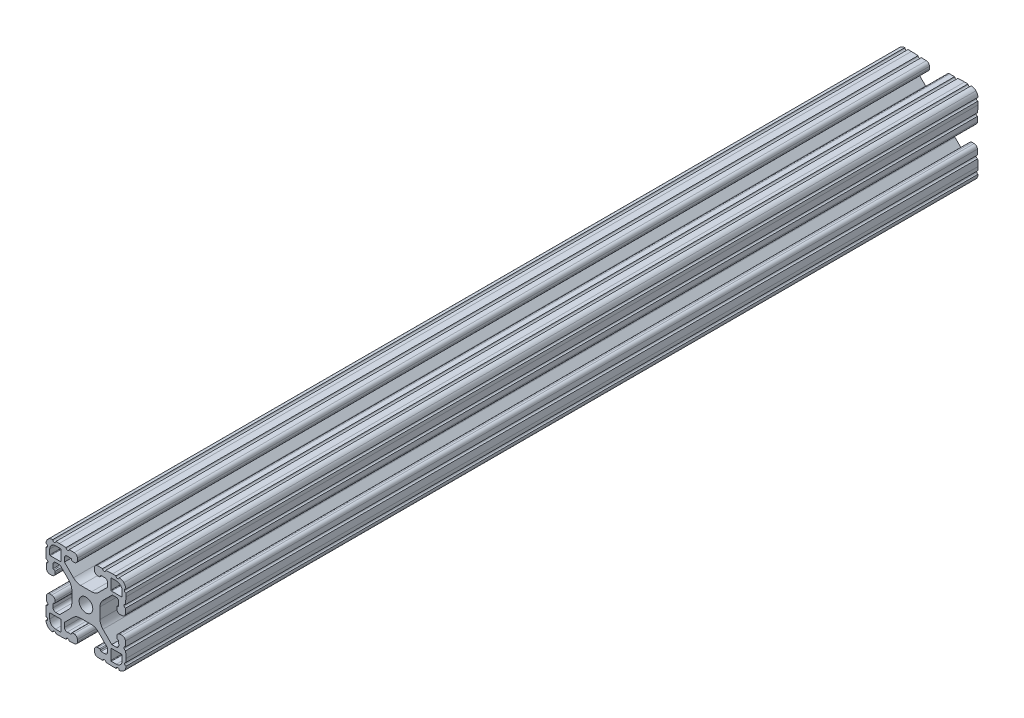
from build123d import *

# Parameters (mm, degrees)
SKETCH1_R           = 3.2639
BOSS_EXTRUDE1_DEPTH = 406.4


with BuildPart() as part:
    # Sketch1 → Boss-Extrude1 (new body)
    with BuildSketch(Plane(origin=(0, 0, -25.4), x_dir=(-1, 0, 0), z_dir=(0, 0, -1))):
        with BuildLine():
            Line((-88.043721549, 91.862643967), (-86.29674679, 91.923648859))
            ThreePointArc((-86.29674679, 91.923648859), (-85.370208675, 91.567983831), (-84.982425017, 90.654422489))
            Line((-84.982425017, 90.654422489), (-84.982425017, 88.800173916))
            Line((-84.982425017, 88.800173916), (-89.306565884, 84.476033049))
            ThreePointArc((-89.306565884, 84.476033049), (-90.866149908, 83.406077005), (-92.719610366, 83.029523439))
            Line((-92.719610366, 83.029523439), (-97.961628589, 83.029523439))
            ThreePointArc((-97.961628589, 83.029523439), (-99.779298356, 83.391080435), (-101.320244378, 84.42070765))
            Line((-101.320244378, 84.42070765), (-105.516001761, 88.616465033))
            Line((-105.516001761, 88.616465033), (-105.516001761, 90.731330035))
            ThreePointArc((-105.516001761, 90.731330035), (-105.128218103, 91.644891377), (-104.201679988, 92.000556406))
            Line((-104.201679988, 92.000556406), (-102.454705229, 91.939551513))
            ThreePointArc((-102.454705229, 91.939551513), (-102.193933359, 91.823448504), (-102.087001761, 91.558783602))
            ThreePointArc((-102.087001761, 91.558783602), (-102.010859042, 91.249291513), (-101.726191901, 91.105946874))
            Line((-101.726191901, 91.105946874), (-100.929727576, 91.078102142))
            ThreePointArc((-100.929727576, 91.078102142), (-99.780779944, 91.519102656), (-99.299905511, 92.651940638))
            Line((-99.299905511, 92.651940638), (-99.299905511, 93.566848638))
            ThreePointArc((-99.299905511, 93.566848638), (-99.741889517, 94.660796975), (-100.819746715, 95.140689345))
            Line((-100.819746715, 95.140689345), (-103.211918901, 95.224224422))
            ThreePointArc((-103.211918901, 95.224224422), (-104.000045777, 94.489281495), (-104.734990687, 95.277406522))
            Line((-104.734990687, 95.277406522), (-107.935905676, 95.389166912))
            Line((-107.935905676, 95.389166912), (-109.561454876, 95.389166912))
            ThreePointArc((-109.561454876, 95.389166912), (-110.323454876, 94.627166912), (-111.085454876, 95.389166912))
            ThreePointArc((-111.085454876, 95.389166912), (-112.308767787, 95.144035599), (-113.343184761, 94.446493225))
            ThreePointArc((-113.343184761, 94.446493225), (-114.04072548, 93.412075135), (-114.285854836, 92.188761832))
            ThreePointArc((-114.285854836, 92.188761832), (-113.523853616, 91.426762441), (-114.285853616, 90.664761832))
            Line((-114.285853616, 90.664761832), (-114.285853616, 89.039212632))
            Line((-114.285853616, 89.039212632), (-114.174093219, 85.838297643))
            ThreePointArc((-114.174093219, 85.838297643), (-113.385968191, 85.103352735), (-114.120911115, 84.315225857))
            Line((-114.120911115, 84.315225857), (-114.037376031, 81.923053667))
            ThreePointArc((-114.037376031, 81.923053667), (-113.55748366, 80.845196472), (-112.463535325, 80.403212468))
            Line((-112.463535325, 80.403212468), (-111.548627325, 80.403212468))
            ThreePointArc((-111.548627325, 80.403212468), (-110.415788905, 80.884087354), (-109.974788872, 82.033035791))
            Line((-109.974788872, 82.033035791), (-110.002634241, 82.829500094))
            ThreePointArc((-110.002634241, 82.829500094), (-110.118742417, 83.090261917), (-110.383401914, 83.197188))
            ThreePointArc((-110.383401914, 83.197188), (-110.693757401, 83.272605688), (-110.837665276, 83.557735272))
            Line((-110.837665276, 83.557735272), (-110.898671566, 85.304709982))
            ThreePointArc((-110.898671566, 85.304709982), (-110.543006925, 86.231248747), (-109.62944523, 86.61903277))
            Line((-109.62944523, 86.61903277), (-107.807161806, 86.61903277))
            Line((-107.807161806, 86.61903277), (-103.364925613, 82.176810793))
            ThreePointArc((-103.364925613, 82.176810793), (-102.335294479, 80.635862907), (-101.973736029, 78.81818963))
            Line((-101.973736029, 78.81818963), (-101.973736029, 73.576034207))
            ThreePointArc((-101.973736029, 73.576034207), (-102.335293752, 71.758362684), (-103.364922926, 70.21741573))
            Line((-103.364922926, 70.21741573), (-107.560683666, 66.021661704))
            Line((-107.560683666, 66.021661704), (-109.652436558, 66.021661704))
            ThreePointArc((-109.652436558, 66.021661704), (-110.565998503, 66.409445617), (-110.921663765, 67.335984343))
            Line((-110.921663765, 67.335984343), (-110.860658873, 69.082959102))
            ThreePointArc((-110.860658873, 69.082959102), (-110.744555864, 69.343730973), (-110.479890961, 69.45066257))
            ThreePointArc((-110.479890961, 69.45066257), (-110.173494703, 69.529390272), (-110.032185196, 69.812424443))
            Line((-110.032185196, 69.812424443), (-110.004340464, 70.608888768))
            ThreePointArc((-110.004340464, 70.608888768), (-110.445340978, 71.7578364), (-111.57817896, 72.238710833))
            Line((-111.57817896, 72.238710833), (-112.49308696, 72.238710833))
            ThreePointArc((-112.49308696, 72.238710833), (-113.587035297, 71.796726827), (-114.066927667, 70.718869629))
            Line((-114.066927667, 70.718869629), (-114.150462744, 68.326697443))
            ThreePointArc((-114.150462744, 68.326697443), (-113.415519817, 67.538570567), (-114.203644843, 66.803625657))
            Line((-114.203644843, 66.803625657), (-114.315405233, 63.602710668))
            Line((-114.315405233, 63.602710668), (-114.315405233, 61.962557497))
            ThreePointArc((-114.315405233, 61.962557497), (-113.701927281, 61.206106537), (-114.333208228, 60.464447842))
            ThreePointArc((-114.333208228, 60.464447842), (-114.113020459, 59.176546471), (-113.392816136, 58.086372941))
            ThreePointArc((-113.392816136, 58.086372941), (-112.358398046, 57.388832223), (-111.135084743, 57.143702867))
            ThreePointArc((-111.135084743, 57.143702867), (-110.373085352, 57.905704086), (-109.611084743, 57.143704086))
            Line((-109.611084743, 57.143704086), (-107.985535543, 57.143704086))
            Line((-107.985535543, 57.143704086), (-104.784620554, 57.255464483))
            ThreePointArc((-104.784620554, 57.255464483), (-104.049675645, 58.04358951), (-103.261548768, 57.308646586))
            Line((-103.261548768, 57.308646586), (-100.869376578, 57.39218167))
            ThreePointArc((-100.869376578, 57.39218167), (-99.791519383, 57.872074041), (-99.349535378, 58.966022376))
            Line((-99.349535378, 58.966022376), (-99.349535378, 59.880930376))
            ThreePointArc((-99.349535378, 59.880930376), (-99.830409811, 61.013768358), (-100.979357443, 61.454768873))
            Line((-100.979357443, 61.454768873), (-101.775821768, 61.42692414))
            ThreePointArc((-101.775821768, 61.42692414), (-102.036583684, 61.310816174), (-102.143509978, 61.046156762))
            ThreePointArc((-102.143509978, 61.046156762), (-102.222494916, 60.740061862), (-102.505377386, 60.598958297))
            Line((-102.505377386, 60.598958297), (-104.252352145, 60.537953405))
            ThreePointArc((-104.252352145, 60.537953405), (-105.17889026, 60.893618433), (-105.566673918, 61.807179775))
            Line((-105.566673918, 61.807179775), (-105.566673918, 63.629462758))
            Line((-105.566673918, 63.629462758), (-101.131142468, 68.064994208))
            ThreePointArc((-101.131142468, 68.064994208), (-99.590196446, 69.094621422), (-97.772526678, 69.456178419))
            Line((-97.772526678, 69.456178419), (-92.530356056, 69.456178419))
            ThreePointArc((-92.530356056, 69.456178419), (-90.712686289, 69.094621422), (-89.171740267, 68.064994208))
            Line((-89.171740267, 68.064994208), (-84.975982884, 63.869236825))
            Line((-84.975982884, 63.869236825), (-84.975982884, 61.781050107))
            ThreePointArc((-84.975982884, 61.781050107), (-85.363766542, 60.867488765), (-86.290304657, 60.511823736))
            Line((-86.290304657, 60.511823736), (-88.037279416, 60.572828629))
            ThreePointArc((-88.037279416, 60.572828629), (-88.298051286, 60.688931638), (-88.404982884, 60.95359654))
            ThreePointArc((-88.404982884, 60.95359654), (-88.466593694, 61.278962759), (-88.759626911, 61.433204782))
            Line((-88.759626911, 61.433204782), (-89.556091237, 61.461049514))
            ThreePointArc((-89.556091237, 61.461049514), (-90.705038868, 61.020049), (-91.185913301, 59.887211018))
            Line((-91.185913301, 59.887211018), (-91.185913301, 58.972303018))
            ThreePointArc((-91.185913301, 58.972303018), (-90.743929295, 57.878354681), (-89.666072098, 57.398462311))
            Line((-89.666072098, 57.398462311), (-87.273899911, 57.314927234))
            ThreePointArc((-87.273899911, 57.314927234), (-86.485773036, 58.049870161), (-85.750828126, 57.261745135))
            Line((-85.750828126, 57.261745135), (-82.549913136, 57.149984745))
            Line((-82.549913136, 57.149984745), (-80.924363936, 57.149984745))
            ThreePointArc((-80.924363936, 57.149984745), (-80.162363936, 57.911984745), (-79.400363936, 57.149984745))
            ThreePointArc((-79.400363936, 57.149984745), (-78.177051025, 57.395116058), (-77.142634052, 58.092658432))
            ThreePointArc((-77.142634052, 58.092658432), (-76.445094372, 59.127074031), (-76.199963977, 60.350384428))
            ThreePointArc((-76.199963977, 60.350384428), (-76.961961268, 61.112385783), (-76.199961268, 61.874384428))
            Line((-76.199961268, 61.874384428), (-76.199961268, 63.499933628))
            Line((-76.199961268, 63.499933628), (-76.311721666, 66.700848617))
            ThreePointArc((-76.311721666, 66.700848617), (-77.099846694, 67.435793525), (-76.364903769, 68.223920403))
            Line((-76.364903769, 68.223920403), (-76.448438853, 70.616092593))
            ThreePointArc((-76.448438853, 70.616092593), (-76.928331225, 71.693949788), (-78.02227956, 72.135933792))
            Line((-78.02227956, 72.135933792), (-78.93718756, 72.135933792))
            ThreePointArc((-78.93718756, 72.135933792), (-80.07002598, 71.655058906), (-80.511026012, 70.506110469))
            Line((-80.511026012, 70.506110469), (-80.483180643, 69.709646166))
            ThreePointArc((-80.483180643, 69.709646166), (-80.367072468, 69.448884343), (-80.102412971, 69.34195826))
            ThreePointArc((-80.102412971, 69.34195826), (-79.796317908, 69.262973649), (-79.655214052, 68.980091239))
            Line((-79.655214052, 68.980091239), (-79.594207761, 67.233116529))
            ThreePointArc((-79.594207761, 67.233116529), (-79.949872402, 66.306577764), (-80.863434097, 65.918793741))
            Line((-80.863434097, 65.918793741), (-82.685717521, 65.918793741))
            Line((-82.685717521, 65.918793741), (-87.121258001, 70.35431293))
            ThreePointArc((-87.121258001, 70.35431293), (-88.150863946, 71.895196205), (-88.512450271, 73.712794894))
            Line((-88.512450271, 73.712794894), (-88.512606864, 78.954950317))
            ThreePointArc((-88.512606864, 78.954950317), (-88.151076291, 80.772698182), (-87.121419968, 82.313710679))
            Line((-87.121419968, 82.313710679), (-82.925659228, 86.509464706))
            Line((-82.925659228, 86.509464706), (-80.837473527, 86.509464706))
            ThreePointArc((-80.837473527, 86.509464706), (-79.923911584, 86.121680793), (-79.568246321, 85.195142068))
            Line((-79.568246321, 85.195142068), (-79.629251214, 83.448167309))
            ThreePointArc((-79.629251214, 83.448167309), (-79.745354223, 83.187395438), (-80.010019125, 83.080463841))
            ThreePointArc((-80.010019125, 83.080463841), (-80.335385344, 83.018853031), (-80.489627367, 82.725819813))
            Line((-80.489627367, 82.725819813), (-80.5174721, 81.929355488))
            ThreePointArc((-80.5174721, 81.929355488), (-80.076471586, 80.780407856), (-78.943633603, 80.299533423))
            Line((-78.943633603, 80.299533423), (-78.028725603, 80.299533423))
            ThreePointArc((-78.028725603, 80.299533423), (-76.934777267, 80.741517429), (-76.454884897, 81.819374627))
            Line((-76.454884897, 81.819374627), (-76.37134982, 84.211546813))
            ThreePointArc((-76.37134982, 84.211546813), (-77.106292747, 84.999673689), (-76.31816772, 85.734618599))
            Line((-76.31816772, 85.734618599), (-76.20640733, 88.935533588))
            Line((-76.20640733, 88.935533588), (-76.20640733, 90.561082788))
            ThreePointArc((-76.20640733, 90.561082788), (-76.96840733, 91.323083398), (-76.206406111, 92.085082788))
            ThreePointArc((-76.206406111, 92.085082788), (-76.451535467, 93.308396091), (-77.149076185, 94.342814181))
            ThreePointArc((-77.149076185, 94.342814181), (-78.183493159, 95.040356555), (-79.40680607, 95.285487868))
            ThreePointArc((-79.40680607, 95.285487868), (-80.16880607, 94.523487868), (-80.93080607, 95.285487868))
            Line((-80.93080607, 95.285487868), (-82.55635527, 95.285487868))
            Line((-82.55635527, 95.285487868), (-85.757270259, 95.173727471))
            ThreePointArc((-85.757270259, 95.173727471), (-86.492215168, 94.385602444), (-87.280342045, 95.120545368))
            Line((-87.280342045, 95.120545368), (-89.672514235, 95.037010285))
            ThreePointArc((-89.672514235, 95.037010285), (-90.75037143, 94.557117913), (-91.192355435, 93.463169578))
            Line((-91.192355435, 93.463169578), (-91.192355435, 92.548261578))
            ThreePointArc((-91.192355435, 92.548261578), (-90.711481002, 91.415423596), (-89.56253337, 90.974423082))
            Line((-89.56253337, 90.974423082), (-88.766069045, 91.002267814))
            ThreePointArc((-88.766069045, 91.002267814), (-88.505307129, 91.11837578), (-88.398380835, 91.383035192))
            ThreePointArc((-88.398380835, 91.383035192), (-88.336765486, 91.708407548), (-88.043721549, 91.862643967))
        make_face()
        with Locations((-95.25, 76.2)):
            Circle(SKETCH1_R, mode=Mode.SUBTRACT)
        with BuildLine():
            Line((-83.357745393, 88.294108398), (-83.357745393, 93.170908398))
            ThreePointArc((-83.357745393, 93.170908398), (-83.283351492, 93.350512545), (-83.103748154, 93.424908398))
            Line((-83.103748154, 93.424908398), (-80.766975763, 93.424933798))
            ThreePointArc((-80.766975763, 93.424933798), (-78.791299784, 92.606600882), (-77.972945393, 90.630933798))
            Line((-77.972945393, 90.630933798), (-77.972945393, 88.294108398))
            ThreePointArc((-77.972945393, 88.294108398), (-78.047340271, 88.114503276), (-78.226945393, 88.040108398))
            Line((-78.226945393, 88.040108398), (-83.103745393, 88.040108398))
            ThreePointArc((-83.103745393, 88.040108398), (-83.283350516, 88.114503276), (-83.357745393, 88.294108398))
        make_face(mode=Mode.SUBTRACT)
        with BuildLine():
            Line((-83.357745393, 59.229091602), (-83.357745393, 64.105891602))
            ThreePointArc((-83.357745393, 64.105891602), (-83.283350516, 64.285496724), (-83.103745393, 64.359891602))
            Line((-83.103745393, 64.359891602), (-78.226945393, 64.359891602))
            ThreePointArc((-78.226945393, 64.359891602), (-78.047340271, 64.285496724), (-77.972945393, 64.105891602))
            Line((-77.972945393, 64.105891602), (-77.972945393, 61.769066202))
            ThreePointArc((-77.972945393, 61.769066202), (-78.791299784, 59.793399118), (-80.766975763, 58.975066202))
            Line((-80.766975763, 58.975066202), (-83.103748154, 58.975091602))
            ThreePointArc((-83.103748154, 58.975091602), (-83.283351492, 59.049487455), (-83.357745393, 59.229091602))
        make_face(mode=Mode.SUBTRACT)
        with BuildLine():
            Line((-107.142254607, 93.170908398), (-107.142254607, 88.294108398))
            ThreePointArc((-107.142254607, 88.294108398), (-107.216649484, 88.114503276), (-107.396254607, 88.040108398))
            Line((-107.396254607, 88.040108398), (-112.273054607, 88.040108398))
            ThreePointArc((-112.273054607, 88.040108398), (-112.452659729, 88.114503276), (-112.527054607, 88.294108398))
            Line((-112.527054607, 88.294108398), (-112.527054607, 90.630933798))
            ThreePointArc((-112.527054607, 90.630933798), (-111.708700216, 92.606600882), (-109.733024237, 93.424933798))
            Line((-109.733024237, 93.424933798), (-107.396251846, 93.424908398))
            ThreePointArc((-107.396251846, 93.424908398), (-107.216648508, 93.350512545), (-107.142254607, 93.170908398))
        make_face(mode=Mode.SUBTRACT)
        with BuildLine():
            Line((-107.142254607, 64.105891602), (-107.142254607, 59.229091602))
            ThreePointArc((-107.142254607, 59.229091602), (-107.216648508, 59.049487455), (-107.396251846, 58.975091602))
            Line((-107.396251846, 58.975091602), (-109.733024237, 58.975066202))
            ThreePointArc((-109.733024237, 58.975066202), (-111.708700216, 59.793399118), (-112.527054607, 61.769066202))
            Line((-112.527054607, 61.769066202), (-112.527054607, 64.105891602))
            ThreePointArc((-112.527054607, 64.105891602), (-112.452659729, 64.285496724), (-112.273054607, 64.359891602))
            Line((-112.273054607, 64.359891602), (-107.396254607, 64.359891602))
            ThreePointArc((-107.396254607, 64.359891602), (-107.216649484, 64.285496724), (-107.142254607, 64.105891602))
        make_face(mode=Mode.SUBTRACT)
    extrude(amount=-BOSS_EXTRUDE1_DEPTH)


solid = part.part
